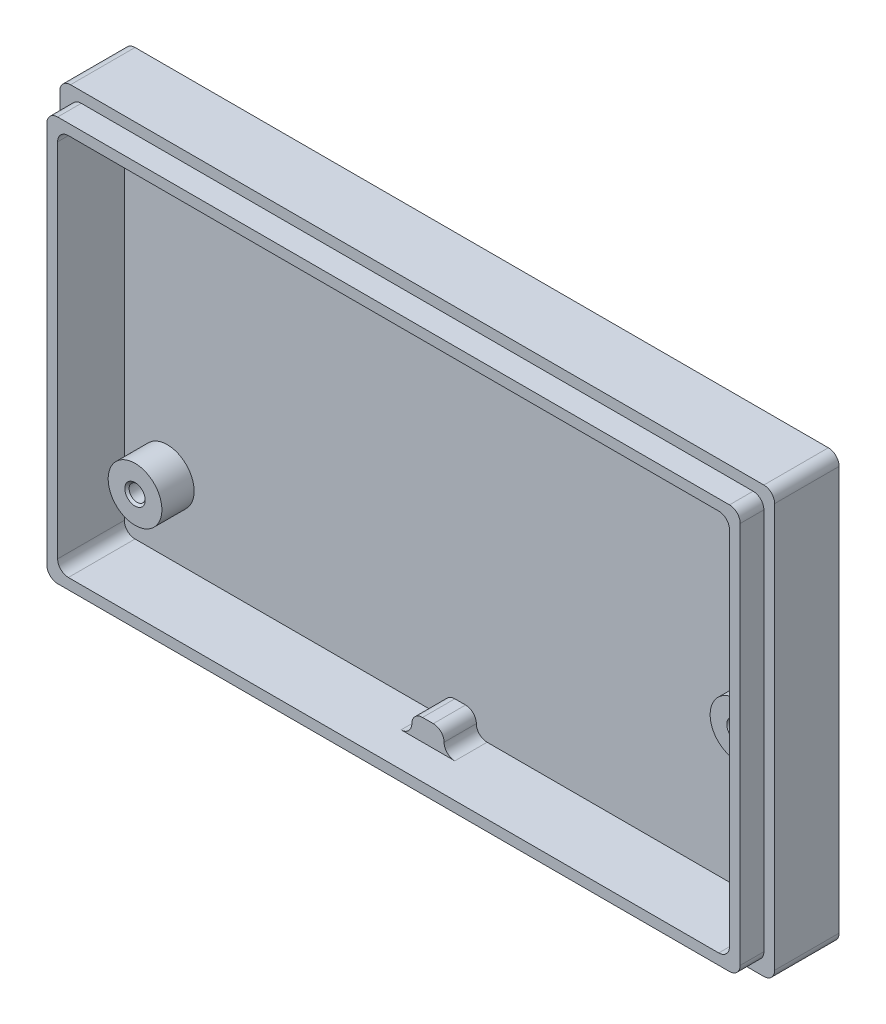
from build123d import *

# Parameters (mm, degrees)
SKETCH4_W            = 66.5
SKETCH4_H            = 39.6
BOSS_EXTRUDE4_DEPTH  = 2
SKETCH5_W            = 66.5
SKETCH5_H            = 39.6
SKETCH5_W_2          = 62.5
SKETCH5_H_2          = 35.6
BOSS_EXTRUDE5_DEPTH  = 4
SKETCH6_R            = 2.5
BOSS_EXTRUDE8_DEPTH  = 3
SKETCH7_R            = 0.75
CUT_EXTRUDE1_DEPTH   = 2
SKETCH9_W            = 64.5
SKETCH9_H            = 37.6
SKETCH9_W_2          = 62.5
SKETCH9_H_2          = 35.6
BOSS_EXTRUDE9_DEPTH  = 2.2
CHAMFER1_SIZE        = 0.2
CHAMFER2_SIZE        = 0.2
SKETCH11_W           = 3
SKETCH11_H           = 2
BOSS_EXTRUDE10_DEPTH = 3
FILLET1_R            = 1


with BuildPart() as part:
    # Sketch4 → Boss-Extrude4 (new body)
    with BuildSketch(Plane.XY):
        with Locations((30.75, 17.3)):
            Rectangle(SKETCH4_W, SKETCH4_H)
    extrude(amount=BOSS_EXTRUDE4_DEPTH)

    # Sketch5 → Boss-Extrude5 (add)
    with BuildSketch(Plane.XY.offset(2)):
        with Locations((30.75, 17.3)):
            Rectangle(SKETCH5_W, SKETCH5_H)
        with Locations((30.75, 17.3)):
            Rectangle(SKETCH5_W_2, SKETCH5_H_2, mode=Mode.SUBTRACT)
    extrude(amount=BOSS_EXTRUDE5_DEPTH)

    # Sketch6 → Boss-Extrude8 (add)
    with BuildSketch(Plane.XY.offset(2)):
        with Locations(Location((3.5, 6.1, 0), (0, 0, 180))):
            Circle(SKETCH6_R)
        with BuildLine():
            Line((59.5, 12.6), (62, 12.6))
            Line((62, 12.6), (62, 17.6))
            Line((62, 17.6), (59.5, 17.6))
            ThreePointArc((59.5, 17.6), (57, 15.1), (59.5, 12.6))
        make_face()
    extrude(amount=BOSS_EXTRUDE8_DEPTH)

    # Sketch7 → Cut-Extrude1 (cut)
    with BuildSketch(Plane.XY.offset(5)):
        with Locations((59.5, 15.1)):
            Circle(SKETCH7_R)
        with Locations((3.5, 6.1)):
            Circle(SKETCH7_R)
    extrude(amount=-CUT_EXTRUDE1_DEPTH, mode=Mode.SUBTRACT)

    # Sketch9 → Boss-Extrude9 (add)
    with BuildSketch(Plane.XY.offset(6)):
        with Locations((30.75, 17.3)):
            Rectangle(SKETCH9_W, SKETCH9_H)
        with Locations((30.75, 17.3)):
            Rectangle(SKETCH9_W_2, SKETCH9_H_2, mode=Mode.SUBTRACT)
    extrude(amount=BOSS_EXTRUDE9_DEPTH)

    # Chamfer1
    chamfer1_edges = [part.edges().sort_by_distance(p)[0] for p in [
        (2.75, 6.1, 5),
    ]]
    chamfer(chamfer1_edges, length=CHAMFER1_SIZE)

    # Chamfer2
    chamfer2_edges = [part.edges().sort_by_distance(p)[0] for p in [
        (58.75, 15.1, 5),
    ]]
    chamfer(chamfer2_edges, length=CHAMFER2_SIZE)

    # Sketch11 → Boss-Extrude10 (add)
    with BuildSketch(Plane.XY.offset(2)):
        with Locations((4, 34.1)):
            Rectangle(SKETCH11_W, SKETCH11_H)
        with Locations((30.75, 34.1)):
            Rectangle(SKETCH11_W, SKETCH11_H)
        with Locations((57.5, 34.1)):
            Rectangle(SKETCH11_W, SKETCH11_H)
        with Locations((30.75, 0.5)):
            Rectangle(SKETCH11_W, SKETCH11_H)
    extrude(amount=BOSS_EXTRUDE10_DEPTH)

    # Fillet1
    fillet1_edges = [part.edges().sort_by_distance(p)[0] for p in [
        (-1.5, 36.1, 7.1),
        (-2.5, 37.1, 3),
        (-1.5, -1.5, 7.1),
        (-2.5, -2.5, 3),
        (63, 36.1, 7.1),
        (63, -1.5, 7.1),
        (64, -2.5, 3),
        (64, 37.1, 3),
        (-0.5, -0.5, 5.1),
        (-0.5, 35.1, 5.1),
        (62, -0.5, 5.1),
        (62, 35.1, 5.1),
        (62, 12.6, 3.5),
        (62, 17.6, 3.5),
        (32.25, -0.5, 3.5),
        (29.25, -0.5, 3.5),
        (56, 35.1, 3.5),
        (59, 35.1, 3.5),
        (32.25, 35.1, 3.5),
        (29.25, 35.1, 3.5),
        (5.5, 35.1, 3.5),
        (2.5, 35.1, 3.5),
        (29.25, 1.5, 3.5),
        (32.25, 1.5, 3.5),
        (59, 33.1, 3.5),
        (56, 33.1, 3.5),
        (32.25, 33.1, 3.5),
        (29.25, 33.1, 3.5),
        (5.5, 33.1, 3.5),
        (2.5, 33.1, 3.5),
    ]]
    fillet(fillet1_edges, radius=FILLET1_R - 0.0001)  # a hair under: the kernel refuses the full size


solid = part.part
